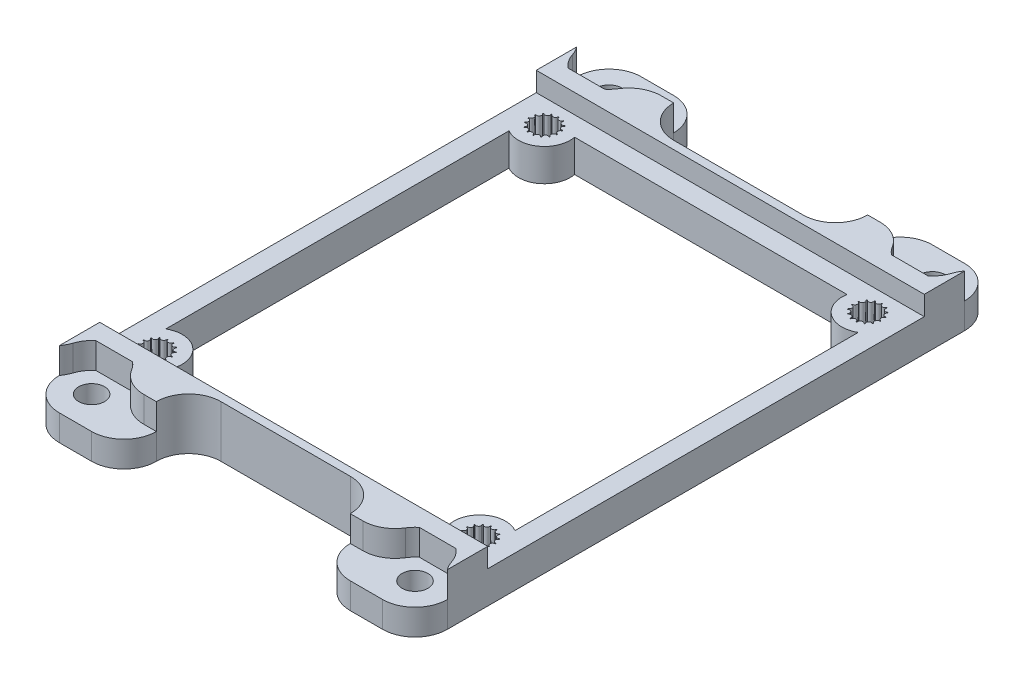
from build123d import *

# Parameters (mm, degrees)
SKETCH1_W                                  = 60
SKETCH1_H                                  = 70
BOSS_EXTRUDE1_DEPTH                        = 8
CUT_EXTRUDE1_DEPTH                         = 8
MIRROR1_AT_THE_SECOND_PLANE_COPY_1_DEPTH   = 8
SKETCH3_W                                  = 15
SKETCH3_H                                  = 10
SKETCH3_R                                  = 2
BOSS_EXTRUDE2_DEPTH                        = 8
MIRROR2_AT_THE_SECOND_PLANE_COPY_1_SKETC_W = 15
MIRROR2_AT_THE_SECOND_PLANE_COPY_1_SKETC_H = 10
MIRROR2_AT_THE_SECOND_PLANE_COPY_1_SKETC_R = 2
MIRROR2_AT_THE_SECOND_PLANE_COPY_1_DEPTH   = 8
FILLET1_R                                  = 5
CUT_EXTRUDE2_DEPTH                         = 4
MIRROR4_AT_THE_SECOND_PLANE_COPY_1_DEPTH   = 4
FILLET2_R                                  = 5
SKETCH5_W                                  = 40
SKETCH5_H                                  = 50
CUT_EXTRUDE3_DEPTH                         = 13
SKETCH6_W                                  = 62
SKETCH6_H                                  = 67.5
CUT_EXTRUDE4_DEPTH                         = 3
SKETCH7_W                                  = 40
SKETCH7_H                                  = 50
CUT_EXTRUDE5_DEPTH                         = 14


# Some blends are built 0.0001 mm under size
with BuildPart() as part:
    # Sketch1 → Boss-Extrude1 (new body)
    with BuildSketch(Plane(origin=(0, 0, 0), x_dir=(1, 0, 0), z_dir=(0, 1, 0))):
        with Locations((30, 35)):
            Rectangle(SKETCH1_W, SKETCH1_H)
    extrude(amount=BOSS_EXTRUDE1_DEPTH)

    # Sketch2 → Cut-Extrude1 (cut)
    with BuildSketch(Plane(origin=(0, 8, 0), x_dir=(1, 0, 0), z_dir=(0, 1, 0))):
        with BuildLine():
            ThreePointArc((7.160667609, 4.372293474), (6.839865506, 4.806622343), (7.243959363, 5.164761577))
            ThreePointArc((7.243959363, 5.164761577), (7.237674265, 5.235189042), (7.229179325, 5.305384245))
            ThreePointArc((7.229179325, 5.305384245), (6.759454555, 5.57168144), (6.982944313, 6.063217688))
            ThreePointArc((6.982944313, 6.063217688), (6.948557159, 6.125), (6.912245684, 6.185671305))
            ThreePointArc((6.912245684, 6.185671305), (6.374817927, 6.237891622), (6.379060176, 6.777833803))
            ThreePointArc((6.379060176, 6.777833803), (6.322516818, 6.820288237), (6.264667392, 6.860945025))
            ThreePointArc((6.264667392, 6.860945025), (5.75246279, 6.690059097), (5.536724007, 7.185046302))
            ThreePointArc((5.536724007, 7.185046302), (5.467801304, 7.200832102), (5.398416619, 7.214444444))
            ThreePointArc((5.398416619, 7.214444444), (5, 6.85), (4.601583381, 7.214444444))
            ThreePointArc((4.601583381, 7.214444444), (4.532198696, 7.200832102), (4.463275993, 7.185046302))
            ThreePointArc((4.463275993, 7.185046302), (4.479414078, 7.121153089), (4.484842553, 7.05547728))
            ThreePointArc((4.484842553, 7.05547728), (4.185331413, 6.668305497), (3.735332608, 6.860945025))
            ThreePointArc((3.735332608, 6.860945025), (3.677483182, 6.820288237), (3.620939824, 6.777833803))
            ThreePointArc((3.620939824, 6.777833803), (3.700218564, 6.651820533), (3.727924143, 6.505543864))
            ThreePointArc((3.727924143, 6.505543864), (3.50671462, 6.147725523), (3.087754316, 6.185671305))
            ThreePointArc((3.087754316, 6.185671305), (3.051442841, 6.125), (3.017055687, 6.063217688))
            ThreePointArc((3.017055687, 6.063217688), (3.193869104, 5.915772772), (3.260122838, 5.695288237))
            ThreePointArc((3.260122838, 5.695288237), (3.109400931, 5.382461716), (2.770820675, 5.305384245))
            ThreePointArc((2.770820675, 5.305384245), (2.762325735, 5.235189042), (2.756040637, 5.164761577))
            ThreePointArc((2.756040637, 5.164761577), (3.042937532, 5.049867127), (3.162325735, 4.764810958))
            ThreePointArc((3.162325735, 4.764810958), (3.071196794, 4.510648276), (2.839332391, 4.372293474))
            ThreePointArc((2.839332391, 4.372293474), (2.860122838, 4.304711763), (2.883026546, 4.237816691))
            ThreePointArc((2.883026546, 4.237816691), (3.266656087, 4.212169481), (3.451442841, 3.875))
            ThreePointArc((3.451442841, 3.875), (3.40640772, 3.690609287), (3.281443165, 3.547738864))
            ThreePointArc((3.281443165, 3.547738864), (3.327924143, 3.494456136), (3.376056398, 3.442660224))
            ThreePointArc((3.376056398, 3.442660224), (3.817892025, 3.554258631), (4.077483182, 3.179711763))
            ThreePointArc((4.077483182, 3.179711763), (4.063028211, 3.073151777), (4.020708029, 2.974293398))
            ThreePointArc((4.020708029, 2.974293398), (4.084842553, 2.94452272), (4.149880851, 2.916781953))
            ThreePointArc((4.149880851, 2.916781953), (4.591666595, 3.194722659), (4.932198696, 2.799167898))
            ThreePointArc((4.932198696, 2.799167898), (4.931473708, 2.775095823), (4.929301372, 2.751111007))
            ThreePointArc((4.929301372, 2.751111007), (5, 2.75), (5.070698628, 2.751111007))
            ThreePointArc((5.070698628, 2.751111007), (5.384636628, 3.190426939), (5.850119149, 2.916781953))
            ThreePointArc((5.850119149, 2.916781953), (5.915157447, 2.94452272), (5.979291971, 2.974293398))
            ThreePointArc((5.979291971, 2.974293398), (6.087402717, 3.50331856), (6.623943602, 3.442660224))
            ThreePointArc((6.623943602, 3.442660224), (6.672075857, 3.494456136), (6.718556835, 3.547738864))
            ThreePointArc((6.718556835, 3.547738864), (6.602146997, 4.075), (7.116973454, 4.237816691))
            ThreePointArc((7.116973454, 4.237816691), (7.139877162, 4.304711763), (7.160667609, 4.372293474))
        make_face()
    cut_extrude1 = extrude(amount=-CUT_EXTRUDE1_DEPTH, mode=Mode.SUBTRACT)

    # Mirror1: Cut-Extrude1 across plane
    add(cut_extrude1.mirror(Plane(origin=(0, 0, -35), x_dir=(1, 0, 0), z_dir=(0, 0, -1))), mode=Mode.SUBTRACT)

    # Mirror1 at the second plane: Cut-Extrude1 across plane
    add(cut_extrude1.mirror(Plane.ZY.offset(-30)), mode=Mode.SUBTRACT)

    # Mirror1 at the second plane copy 1 sketc → Mirror1 at the second plane copy 1 (cut)
    with BuildSketch(Plane(origin=(60, 8, -70), x_dir=(-1, 0, 0), z_dir=(0, 1, 0))):
        with BuildLine():
            ThreePointArc((7.160667609, 4.372293474), (6.839865506, 4.806622343), (7.243959363, 5.164761577))
            ThreePointArc((7.243959363, 5.164761577), (7.237674265, 5.235189042), (7.229179325, 5.305384245))
            ThreePointArc((7.229179325, 5.305384245), (6.759454555, 5.57168144), (6.982944313, 6.063217688))
            ThreePointArc((6.982944313, 6.063217688), (6.948557159, 6.125), (6.912245684, 6.185671305))
            ThreePointArc((6.912245684, 6.185671305), (6.374817927, 6.237891622), (6.379060176, 6.777833803))
            ThreePointArc((6.379060176, 6.777833803), (6.322516818, 6.820288237), (6.264667392, 6.860945025))
            ThreePointArc((6.264667392, 6.860945025), (5.75246279, 6.690059097), (5.536724007, 7.185046302))
            ThreePointArc((5.536724007, 7.185046302), (5.467801304, 7.200832102), (5.398416619, 7.214444444))
            ThreePointArc((5.398416619, 7.214444444), (5, 6.85), (4.601583381, 7.214444444))
            ThreePointArc((4.601583381, 7.214444444), (4.532198696, 7.200832102), (4.463275993, 7.185046302))
            ThreePointArc((4.463275993, 7.185046302), (4.479414078, 7.121153089), (4.484842553, 7.05547728))
            ThreePointArc((4.484842553, 7.05547728), (4.185331413, 6.668305497), (3.735332608, 6.860945025))
            ThreePointArc((3.735332608, 6.860945025), (3.677483182, 6.820288237), (3.620939824, 6.777833803))
            ThreePointArc((3.620939824, 6.777833803), (3.700218564, 6.651820533), (3.727924143, 6.505543864))
            ThreePointArc((3.727924143, 6.505543864), (3.50671462, 6.147725523), (3.087754316, 6.185671305))
            ThreePointArc((3.087754316, 6.185671305), (3.051442841, 6.125), (3.017055687, 6.063217688))
            ThreePointArc((3.017055687, 6.063217688), (3.193869104, 5.915772772), (3.260122838, 5.695288237))
            ThreePointArc((3.260122838, 5.695288237), (3.109400931, 5.382461716), (2.770820675, 5.305384245))
            ThreePointArc((2.770820675, 5.305384245), (2.762325735, 5.235189042), (2.756040637, 5.164761577))
            ThreePointArc((2.756040637, 5.164761577), (3.042937532, 5.049867127), (3.162325735, 4.764810958))
            ThreePointArc((3.162325735, 4.764810958), (3.071196794, 4.510648276), (2.839332391, 4.372293474))
            ThreePointArc((2.839332391, 4.372293474), (2.860122838, 4.304711763), (2.883026546, 4.237816691))
            ThreePointArc((2.883026546, 4.237816691), (3.266656087, 4.212169481), (3.451442841, 3.875))
            ThreePointArc((3.451442841, 3.875), (3.40640772, 3.690609287), (3.281443165, 3.547738864))
            ThreePointArc((3.281443165, 3.547738864), (3.327924143, 3.494456136), (3.376056398, 3.442660224))
            ThreePointArc((3.376056398, 3.442660224), (3.817892025, 3.554258631), (4.077483182, 3.179711763))
            ThreePointArc((4.077483182, 3.179711763), (4.063028211, 3.073151777), (4.020708029, 2.974293398))
            ThreePointArc((4.020708029, 2.974293398), (4.084842553, 2.94452272), (4.149880851, 2.916781953))
            ThreePointArc((4.149880851, 2.916781953), (4.591666595, 3.194722659), (4.932198696, 2.799167898))
            ThreePointArc((4.932198696, 2.799167898), (4.931473708, 2.775095823), (4.929301372, 2.751111007))
            ThreePointArc((4.929301372, 2.751111007), (5, 2.75), (5.070698628, 2.751111007))
            ThreePointArc((5.070698628, 2.751111007), (5.384636628, 3.190426939), (5.850119149, 2.916781953))
            ThreePointArc((5.850119149, 2.916781953), (5.915157447, 2.94452272), (5.979291971, 2.974293398))
            ThreePointArc((5.979291971, 2.974293398), (6.087402717, 3.50331856), (6.623943602, 3.442660224))
            ThreePointArc((6.623943602, 3.442660224), (6.672075857, 3.494456136), (6.718556835, 3.547738864))
            ThreePointArc((6.718556835, 3.547738864), (6.602146997, 4.075), (7.116973454, 4.237816691))
            ThreePointArc((7.116973454, 4.237816691), (7.139877162, 4.304711763), (7.160667609, 4.372293474))
        make_face()
    extrude(amount=-MIRROR1_AT_THE_SECOND_PLANE_COPY_1_DEPTH, mode=Mode.SUBTRACT)

    # Sketch3 → Boss-Extrude2 (add)
    with BuildSketch(Plane(origin=(0, 8, 0), x_dir=(1, 0, 0), z_dir=(0, 1, 0))):
        with Locations((7.5, -5)):
            Rectangle(SKETCH3_W, SKETCH3_H)
        with Locations(Location((5, -5, 0), (0, 0, 270))):
            Circle(SKETCH3_R, mode=Mode.SUBTRACT)
    boss_extrude2 = extrude(amount=-BOSS_EXTRUDE2_DEPTH)

    # Mirror2: Boss-Extrude2 across plane
    add(boss_extrude2.mirror(Plane(origin=(0, 0, -35), x_dir=(1, 0, 0), z_dir=(0, 0, -1))))

    # Mirror2 at the second plane: Boss-Extrude2 across plane
    add(boss_extrude2.mirror(Plane.ZY.offset(-30)))

    # Mirror2 at the second plane copy 1 sketc → Mirror2 at the second plane copy 1 (add)
    with BuildSketch(Plane(origin=(60, 8, -70), x_dir=(-1, 0, 0), z_dir=(0, 1, 0))):
        with Locations((7.5, -5)):
            Rectangle(MIRROR2_AT_THE_SECOND_PLANE_COPY_1_SKETC_W, MIRROR2_AT_THE_SECOND_PLANE_COPY_1_SKETC_H)
        with Locations(Location((5, -5, 0), (0, 0, 270))):
            Circle(MIRROR2_AT_THE_SECOND_PLANE_COPY_1_SKETC_R, mode=Mode.SUBTRACT)
    extrude(amount=-MIRROR2_AT_THE_SECOND_PLANE_COPY_1_DEPTH)

    # Fillet1
    fillet1_edges = [part.edges().sort_by_distance(p)[0] for p in [
        (0, 4, 10),
        (15, 4, 0),
        (15, 4, 10),
        (60, 4, 10),
        (45, 4, 10),
        (45, 4, 0),
        (0, 4, -80),
        (15, 4, -80),
        (15, 4, -70),
        (60, 4, -80),
        (45, 4, -70),
        (45, 4, -80),
    ]]
    fillet(fillet1_edges, radius=FILLET1_R - 0.0001)  # a hair under: the kernel refuses the full size

    # Sketch4 → Cut-Extrude2 (cut)
    with BuildSketch(Plane(origin=(0, 8, 0), x_dir=(1, 0, 0), z_dir=(0, 1, 0))):
        with BuildLine():
            ThreePointArc((2.171572875, -1.5), (0.939339828, -3.060660172), (0.5, -5))
            Line((0.5, -5), (0, -5))
            Line((0, -5), (0, -11.058479338))
            Line((0, -11.058479338), (15, -11.058479338))
            Line((15, -11.058479338), (15, -5))
            Line((15, -5), (9.5, -5))
            ThreePointArc((9.5, -5), (9.060660172, -3.060660172), (7.828427125, -1.5))
            Line((7.828427125, -1.5), (2.171572875, -1.5))
        make_face()
    cut_extrude2 = extrude(amount=-CUT_EXTRUDE2_DEPTH, mode=Mode.SUBTRACT)

    # Mirror4: Cut-Extrude2 across plane
    add(cut_extrude2.mirror(Plane(origin=(0, 0, -35), x_dir=(1, 0, 0), z_dir=(0, 0, -1))), mode=Mode.SUBTRACT)

    # Mirror4 at the second plane: Cut-Extrude2 across plane
    add(cut_extrude2.mirror(Plane.ZY.offset(-30)), mode=Mode.SUBTRACT)

    # Mirror4 at the second plane copy 1 sketc → Mirror4 at the second plane copy 1 (cut)
    with BuildSketch(Plane(origin=(60, 8, -70), x_dir=(-1, 0, 0), z_dir=(0, 1, 0))):
        with BuildLine():
            ThreePointArc((2.171572875, -1.5), (0.939339828, -3.060660172), (0.5, -5))
            Line((0.5, -5), (0, -5))
            Line((0, -5), (0, -11.058479338))
            Line((0, -11.058479338), (15, -11.058479338))
            Line((15, -11.058479338), (15, -5))
            Line((15, -5), (9.5, -5))
            ThreePointArc((9.5, -5), (9.060660172, -3.060660172), (7.828427125, -1.5))
            Line((7.828427125, -1.5), (2.171572875, -1.5))
        make_face()
    extrude(amount=-MIRROR4_AT_THE_SECOND_PLANE_COPY_1_DEPTH, mode=Mode.SUBTRACT)

    # Fillet2
    # the kernel refuses this fillet: 5 mm, written as the material it takes off along each edge
    with BuildSketch(Plane(origin=(9.5, 16.944368027, 5), x_dir=(1, 0, 0), z_dir=(0, -1, 0)), Plane(origin=(50.5, 16.944368027, -75), x_dir=(-1, 0, 0), z_dir=(0, -1, 0))) as fillet2_piece_1:
        with BuildLine():
            CenterArc((3.577747211, -5), FILLET2_R, 90, 58.243136141)
            ThreePointArc((-0.67369869, -2.368421053), (-0.17170034, -1.231187253), (0, 0))
            Line((0, 0), (3.577747211, 0))
        make_face()
    extrude(amount=12.944368027, mode=Mode.SUBTRACT)
    with BuildSketch(Plane(origin=(0.5, 11.557562368, 5), x_dir=(0.1581138830098117, 0, -0.987420882906352), z_dir=(0, -1, 0)), Plane(origin=(59.5, 11.557562368, -75), x_dir=(-0.15811388300980816, 0, 0.9874208829063527), z_dir=(0, -1, 0))) as fillet2_piece_2:
        with BuildLine():
            CenterArc((2.213594362, -4.937104415), FILLET2_R, 99.097436169, 18.194872339)
            Line((-0.079056942, -0.493710441), (0, 0))
            ThreePointArc((0, 0), (0.711512474, -0.056606027), (1.423024947, 0))
        make_face()
    extrude(amount=7.557562368, mode=Mode.SUBTRACT)
    with BuildSketch(Plane(origin=(50.5, 16.944368027, 5), x_dir=(0.273597167315497, 0, -0.9618443689271856), z_dir=(0, -1, 0)), Plane(origin=(9.5, 16.944368027, -75), x_dir=(-0.2735971673154991, 0, 0.961844368927185), z_dir=(0, -1, 0))) as fillet2_piece_3:
        with BuildLine():
            CenterArc((3.830360342, -4.809221845), FILLET2_R, 105.87843193, 58.243136141)
            Line((-0.978861502, -3.441236008), (0, 0))
            ThreePointArc((0, 0), (1.231187253, -0.17170034), (2.462374506, 0))
        make_face()
    extrude(amount=12.944368027, mode=Mode.SUBTRACT)
    with BuildSketch(Plane(origin=(59.5, 11.557562368, 5), x_dir=(1.0, 0, -9.917400234238133e-12), z_dir=(0, -1, 0)), Plane(origin=(0.5, 11.557562368, -75), x_dir=(-1.0, 0, 9.947598300507231e-12), z_dir=(0, -1, 0))) as fillet2_piece_4:
        with BuildLine():
            CenterArc((4.525, -2.966374049), FILLET2_R, 143.610255323, 18.194872339)
            ThreePointArc((-0.225, -1.40512455), (-0.056606027, -0.711512474), (0, 0))
            Line((0, 0), (0.5, 0))
        make_face()
    extrude(amount=7.557562368, mode=Mode.SUBTRACT)

    # Sketch5 → Cut-Extrude3 (cut)
    with BuildSketch(Plane(origin=(0, 8, 0), x_dir=(1, 0, 0), z_dir=(0, 1, 0))):
        with Locations((30, 35)):
            Rectangle(SKETCH5_W, SKETCH5_H)
    extrude(amount=-CUT_EXTRUDE3_DEPTH, mode=Mode.SUBTRACT)

    # Sketch6 → Cut-Extrude4 (cut)
    with BuildSketch(Plane(origin=(0, 8, 0), x_dir=(1, 0, 0), z_dir=(0, 1, 0))):
        with Locations((30, 35)):
            Rectangle(SKETCH6_W, SKETCH6_H)
    extrude(amount=-CUT_EXTRUDE4_DEPTH, mode=Mode.SUBTRACT)

    # Sketch7 → Cut-Extrude5 (cut)
    with BuildSketch(Plane(origin=(0, 5, 0), x_dir=(1, 0, 0), z_dir=(0, 1, 0))):
        with BuildLine():
            ThreePointArc((57, 61.535898385), (52.682678336, 61.739628809), (51.070941589, 65.75))
            Line((51.070941589, 65.75), (8.929058411, 65.75))
            ThreePointArc((8.929058411, 65.75), (7.317321664, 61.739628809), (3, 61.535898385))
            Line((3, 61.535898385), (3, 8.464101615))
            ThreePointArc((3, 8.464101615), (7.317321664, 8.260371191), (8.929058411, 4.25))
            Line((8.929058411, 4.25), (51.070941589, 4.25))
            ThreePointArc((51.070941589, 4.25), (52.682678336, 8.260371191), (57, 8.464101615))
            Line((57, 8.464101615), (57, 61.535898385))
        make_face()
        with Locations((30, 35)):
            Rectangle(SKETCH7_W, SKETCH7_H, mode=Mode.SUBTRACT)
    extrude(amount=-CUT_EXTRUDE5_DEPTH, mode=Mode.SUBTRACT)


solid = part.part
